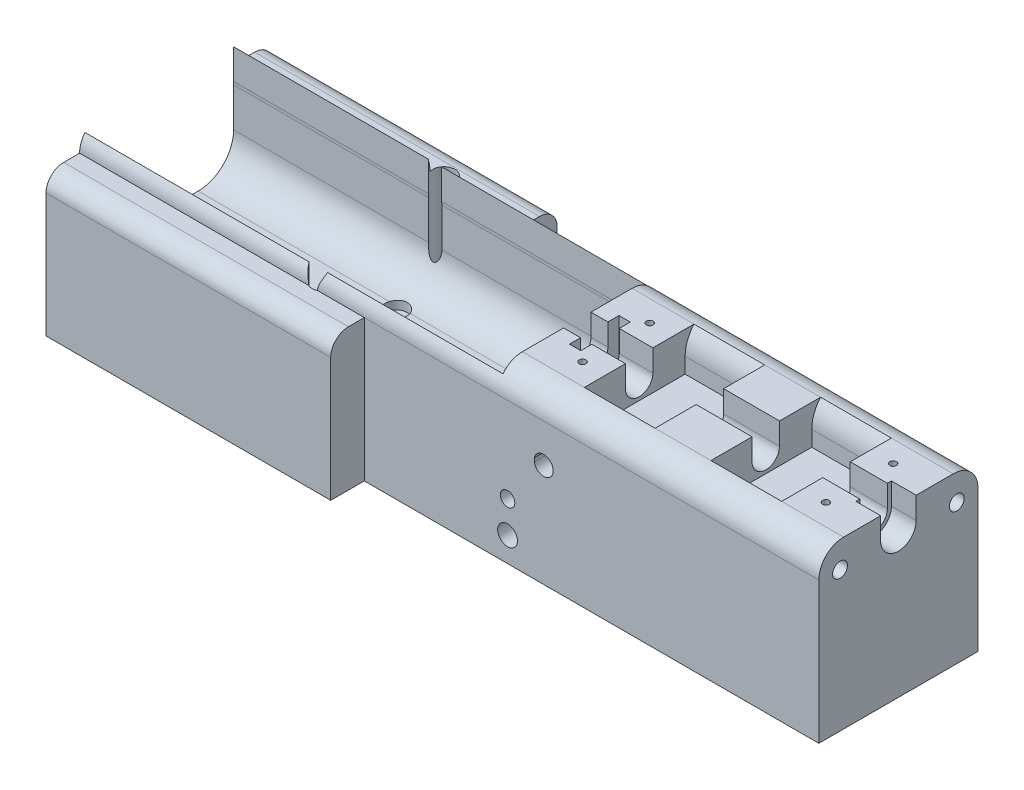
from build123d import *
from OCP.BRepFilletAPI import BRepFilletAPI_MakeChamfer

# Parameters (mm, degrees)
SKETCH1_W            = 218
SKETCH1_H            = 45
BOSS_EXTRUDE1_DEPTH  = 42
SKETCH7_W            = 118.2
SKETCH7_H            = 42
CUT_EXTRUDE17_DEPTH  = 21
SKETCH4_W            = 7.75
SKETCH4_H            = 6.175
CUT_EXTRUDE14_DEPTH  = 97.8
SKETCH5_R            = 3.875
CUT_EXTRUDE15_DEPTH  = 97.8
SKETCH11_W           = 3.2
SKETCH11_H           = 14
CUT_EXTRUDE19_DEPTH  = 12.5
CUT_EXTRUDE43_DEPTH  = 7
SKETCH53_R           = 2.1
CUT_EXTRUDE44_DEPTH  = 95
SKETCH68_R           = 2.65
CUT_EXTRUDE57_DEPTH  = 28.3
BOSS_EXTRUDE2_DEPTH  = 5
SKETCH42_W           = 80.5
SKETCH42_H           = 9.5
BOSS_EXTRUDE3_DEPTH  = 35
FILLET1_START        = -1
FILLET1_DEPTH        = 220
FILLET7_R            = 5
SKETCH56_W           = 15.8
SKETCH56_H           = 10.4
CUT_EXTRUDE47_DEPTH  = 32.15
SKETCH57_W           = 5
SKETCH57_H           = 10.4
CUT_EXTRUDE48_DEPTH  = 15
CUT_EXTRUDE51_DEPTH  = 9
SKETCH83_W           = 20
SKETCH83_H           = 26
CUT_EXTRUDE67_DEPTH  = 11
CHAMFER3_SIZE        = 2.5
CHAMFER3_SIZE_2      = 1.623518983
FILLET20_R           = 10
SKETCH84_R           = 0.95
CUT_EXTRUDE69_DEPTH  = 11
CUT_EXTRUDE76_DEPTH  = 118.2
SKETCH106_R          = 3.1
CUT_EXTRUDE77_DEPTH  = 4.7
SKETCH107_R          = 5.75
CUT_EXTRUDE78_DEPTH  = 4
SKETCH109_R          = 1.5
CUT_EXTRUDE80_DEPTH  = 25
SKETCH110_R          = 1.5
CUT_EXTRUDE81_DEPTH  = 14
SKETCH111_R          = 1.4
CUT_EXTRUDE82_DEPTH  = 7
SKETCH112_R          = 2.8
CUT_EXTRUDE83_DEPTH  = 9.95
SKETCH113_R          = 2.8
SKETCH113_R_2        = 2.05
CUT_EXTRUDE84_DEPTH  = 10
SKETCH59_R           = 1.5
SKETCH59_R_2         = 0.95
CUT_EXTRUDE50_DEPTH  = 6.5
SKETCH115_R          = 5.5
CUT_EXTRUDE85_DEPTH  = 10
CUT_EXTRUDE86_START  = -4
SKETCH116_R          = 2.8
CUT_EXTRUDE86_DEPTH  = 41
CUT_EXTRUDE87_START  = -11.7
SKETCH117_R          = 3.1
CUT_EXTRUDE87_DEPTH  = 44
SKETCH129_R          = 1.4
CUT_EXTRUDE99_DEPTH  = 8
SKETCH131_R          = 1.5
CUT_EXTRUDE100_DEPTH = 7


with BuildPart() as part:
    # Sketch1 → Boss-Extrude1 (new body)
    with BuildSketch(Plane(origin=(0, 0, 0), x_dir=(1, 0, 0), z_dir=(0, 1, 0))):
        with Locations((109, 22.5)):
            Rectangle(SKETCH1_W, SKETCH1_H)
    extrude(amount=BOSS_EXTRUDE1_DEPTH)

    # Sketch7 → Cut-Extrude17 (cut)
    with BuildSketch(Plane(origin=(0, 42, 0), x_dir=(1, 0, 0), z_dir=(0, 1, 0))):
        with Locations((68.1, 22.5)):
            Rectangle(SKETCH7_W, SKETCH7_H)
    extrude(amount=-CUT_EXTRUDE17_DEPTH, mode=Mode.SUBTRACT)

    # Sketch4 → Cut-Extrude14 (cut)
    with BuildSketch(Plane(origin=(218, 0, 0), x_dir=(0, 0, -1), z_dir=(1, 0, 0))):
        with Locations((22.5, 38.9125)):
            Rectangle(SKETCH4_W, SKETCH4_H)
    extrude(amount=-CUT_EXTRUDE14_DEPTH, mode=Mode.SUBTRACT)

    # Sketch5 → Cut-Extrude15 (cut)
    with BuildSketch(Plane(origin=(218, 0, 0), x_dir=(0, 0, -1), z_dir=(1, 0, 0))):
        with Locations((22.5, 35.825)):
            Circle(SKETCH5_R)
    extrude(amount=-CUT_EXTRUDE15_DEPTH, mode=Mode.SUBTRACT)

    # Sketch11 → Cut-Extrude19 (cut)
    with BuildSketch(Plane(origin=(0, 42, 0), x_dir=(1, 0, 0), z_dir=(0, 1, 0))):
        with Locations((133.6, 22.5)):
            Rectangle(SKETCH11_W, SKETCH11_H)
    extrude(amount=-CUT_EXTRUDE19_DEPTH, mode=Mode.SUBTRACT)

    # Sketch52 → Cut-Extrude43 (cut)
    with BuildSketch(Plane(origin=(218, 0, 0), x_dir=(0, 0, -1), z_dir=(1, 0, 0))):
        with BuildLine():
            Line((17.475, 42), (17.475, 35.825))
            ThreePointArc((17.475, 35.825), (22.5, 30.8), (27.525, 35.825))
            Line((27.525, 35.825), (27.525, 42))
            Line((27.525, 42), (17.475, 42))
        make_face()
    extrude(amount=-CUT_EXTRUDE43_DEPTH, mode=Mode.SUBTRACT)

    # Sketch53 → Cut-Extrude44 (cut)
    with BuildSketch(Plane(origin=(218, 0, 0), x_dir=(0, 0, -1), z_dir=(1, 0, 0))):
        with Locations((6, 34.5)):
            Circle(SKETCH53_R)
        with Locations((39, 34.5)):
            Circle(SKETCH53_R)
    extrude(amount=-CUT_EXTRUDE44_DEPTH, mode=Mode.SUBTRACT)

    # Sketch68 → Cut-Extrude57 (cut)
    with BuildSketch(Plane.ZY.offset(-127.2)):
        with Locations((-6, 34.5)):
            Circle(SKETCH68_R)
        with Locations((-39, 34.5)):
            Circle(SKETCH68_R)
    extrude(amount=-CUT_EXTRUDE57_DEPTH, mode=Mode.SUBTRACT)

    # Sketch14 → Boss-Extrude2 (add)
    with BuildSketch(Plane.XZ):
        Polygon((9, -54.5), (89.5, -54.5), (89.5, -45), (218, -45), (218, 0), (89.5, 0), (89.5, 9.5), (9, 9.5), (9, 0), (0, 0), (0, -45), (9, -45), align=None)
    extrude(amount=BOSS_EXTRUDE2_DEPTH)

    # Sketch42 → Boss-Extrude3 (add)
    with BuildSketch(Plane(origin=(0, 0, 0), x_dir=(1, 0, 0), z_dir=(0, 1, 0))):
        with Locations((49.25, -4.75)):
            Rectangle(SKETCH42_W, SKETCH42_H)
        with Locations((49.25, 49.75)):
            Rectangle(SKETCH42_W, SKETCH42_H)
    extrude(amount=BOSS_EXTRUDE3_DEPTH)

    # Fillet1: read off the stored shape, not the designer's step
    # Fillet1 outline → Fillet1 (cut)
    with BuildSketch(Plane.YZ.offset(FILLET1_START)):
        with BuildLine():
            ThreePointArc((42, -38), (39.949747468, -42.949747468), (35, -45))
            Line((35, -45), (42, -45))
            Line((42, -45), (42, -38))
        make_face()
        with BuildLine():
            Line((42, -7), (42, 0))
            Line((42, 0), (35, 0))
            ThreePointArc((35, 0), (39.949747468, -2.050252532), (42, -7))
        make_face()
    extrude(amount=FILLET1_DEPTH, mode=Mode.SUBTRACT)

    # Fillet7
    fillet7_edges = [part.edges().sort_by_distance(p)[0] for p in [
        (49.25, 35, -54.5),
        (49.25, 35, 9.5),
    ]]
    fillet(fillet7_edges, radius=FILLET7_R)

    # Sketch56 → Cut-Extrude47 (cut)
    with BuildSketch(Plane.XZ.offset(5)):
        with Locations((135.1, -14.2)):
            Rectangle(SKETCH56_W, SKETCH56_H)
    extrude(amount=-CUT_EXTRUDE47_DEPTH, mode=Mode.SUBTRACT)

    # Sketch57 → Cut-Extrude48 (cut)
    with BuildSketch(Plane.XZ.offset(5)):
        with Locations((124.7, -14.2)):
            Rectangle(SKETCH57_W, SKETCH57_H)
    extrude(amount=-CUT_EXTRUDE48_DEPTH, mode=Mode.SUBTRACT)

    # Sketch62 → Cut-Extrude51 (cut)
    with BuildSketch(Plane.ZY):
        with BuildLine():
            Line((0, -5), (-45, -5))
            Line((-45, -5), (-45, 35))
            ThreePointArc((-45, 35), (-42.949747468, 39.949747468), (-38, 42))
            Line((-38, 42), (-7, 42))
            ThreePointArc((-7, 42), (-2.050252532, 39.949747468), (0, 35))
            Line((0, 35), (0, -5))
        make_face()
    extrude(amount=-CUT_EXTRUDE51_DEPTH, mode=Mode.SUBTRACT)

    # Sketch83 → Cut-Extrude67 (cut)
    with BuildSketch(Plane(origin=(0, 42, 0), x_dir=(1, 0, 0), z_dir=(0, 1, 0))):
        with Locations((154.7, 22.5)):
            Rectangle(SKETCH83_W, SKETCH83_H)
        with Locations((190.5, 22.5)):
            Rectangle(SKETCH83_W, SKETCH83_H)
    extrude(amount=-CUT_EXTRUDE67_DEPTH, mode=Mode.SUBTRACT)

    # Chamfer3
    chamfer3_edges_1 = [part.edges().sort_by_distance(p)[0] for p in [
        (154.7, 42, -9.5),
    ]]
    chamfer3_side_1 = [part.faces().sort_by_distance(p)[0] for p in [
        (154.7, 42, -9.46752962),
    ]]
    chamfer3_edges_2 = [part.edges().sort_by_distance(p)[0] for p in [
        (190.5, 42, -9.5),
    ]]
    chamfer3_side_2 = [part.faces().sort_by_distance(p)[0] for p in [
        (190.5, 42, -9.46752962),
    ]]
    chamfer3_edges_3 = [part.edges().sort_by_distance(p)[0] for p in [
        (154.7, 42, -35.5),
    ]]
    chamfer3_side_3 = [part.faces().sort_by_distance(p)[0] for p in [
        (154.7, 42, -35.53247038),
    ]]
    chamfer3_edges_4 = [part.edges().sort_by_distance(p)[0] for p in [
        (190.5, 42, -35.5),
    ]]
    chamfer3_side_4 = [part.faces().sort_by_distance(p)[0] for p in [
        (190.5, 42, -35.53247038),
    ]]
    chamfer3 = BRepFilletAPI_MakeChamfer(part.part.solid().wrapped)
    for e in chamfer3_edges_1:
        chamfer3.Add(CHAMFER3_SIZE - 0.0001, CHAMFER3_SIZE_2 - 0.0001, e.wrapped, chamfer3_side_1[0].wrapped)
    for e in chamfer3_edges_2:
        chamfer3.Add(CHAMFER3_SIZE - 0.0001, CHAMFER3_SIZE_2 - 0.0001, e.wrapped, chamfer3_side_2[0].wrapped)
    for e in chamfer3_edges_3:
        chamfer3.Add(CHAMFER3_SIZE - 0.0001, CHAMFER3_SIZE_2 - 0.0001, e.wrapped, chamfer3_side_3[0].wrapped)
    for e in chamfer3_edges_4:
        chamfer3.Add(CHAMFER3_SIZE - 0.0001, CHAMFER3_SIZE_2 - 0.0001, e.wrapped, chamfer3_side_4[0].wrapped)
    add(Compound.cast(chamfer3.Shape()), mode=Mode.REPLACE)  # a hair under: the kernel refuses the full size

    # Fillet20
    # the kernel refuses this fillet: 10 mm, written as the material it takes off along each edge
    with BuildSketch(Plane(origin=(180.5, 40.376581017, -35.5), x_dir=(0, -1, 0), z_dir=(1, 0, 0))) as fillet20_piece_1:
        with BuildLine():
            CenterArc((4.990845904, 10), FILLET20_R, 228.591244129, 41.408755871)
            Line((-1.623418983, 2.4999), (-1.755704281, 2.349898))
            ThreePointArc((-1.755704281, 2.349898), (-0.97944468, 1.141023848), (-0.167735188, -0.108926152))
            Line((-0.167735188, -0.108926152), (0, -0.2))
            Line((0, -0.2), (4.990845904, -0.2))
            Line((4.990845904, -0.2), (4.990845904, 0))
        make_face()
    extrude(amount=20, mode=Mode.SUBTRACT)
    with BuildSketch(Plane(origin=(200.5, 40.376581017, -9.5), x_dir=(0, 0.5446307621074148, 0.8386759403764346), z_dir=(-1, 0, 0))) as fillet20_piece_2:
        with BuildLine():
            CenterArc((5.668591196, -9.632010003), FILLET20_R, 105.591809311, 41.408755871)
            Line((-2.718168208, -4.185702381), (-2.885903396, -4.076776229))
            Line((-2.885903396, -4.076776229), (-0.167735188, 0.108926152))
            Line((-0.167735188, 0.108926152), (0, 0.2))
            ThreePointArc((0, 0.2), (1.490384951, 0.2), (2.927013475, 0.1926402))
            Line((2.927013475, 0.1926402), (2.980769901, 0))
        make_face()
    extrude(amount=20, mode=Mode.SUBTRACT)
    with BuildSketch(Plane(origin=(164.7, 40.376581017, -35.5), x_dir=(0, 0.5446307621074188, -0.8386759403764318), z_dir=(-1, 0, 0))) as fillet20_piece_3:
        with BuildLine():
            CenterArc((5.668591196, 9.632010003), FILLET20_R, 212.999434818, 41.408755871)
            Line((-2.718168208, 4.185702381), (-2.885903396, 4.076776229))
            Line((-2.885903396, 4.076776229), (-0.167735188, -0.108926152))
            Line((-0.167735188, -0.108926152), (0, -0.2))
            ThreePointArc((0, -0.2), (1.490384951, -0.2), (2.927013475, -0.1926402))
            Line((2.927013475, -0.1926402), (2.980769901, 0))
        make_face()
    extrude(amount=20, mode=Mode.SUBTRACT)
    with BuildSketch(Plane(origin=(144.7, 40.376581017, -9.5), x_dir=(0, -1, 0), z_dir=(1, 0, 0))) as fillet20_piece_4:
        with BuildLine():
            CenterArc((4.990845904, -10), FILLET20_R, 90, 41.408755871)
            Line((-1.623418983, -2.4999), (-1.755704281, -2.349898))
            ThreePointArc((-1.755704281, -2.349898), (-0.97944468, -1.141023848), (-0.167735188, 0.108926152))
            Line((-0.167735188, 0.108926152), (0, 0.2))
            Line((0, 0.2), (4.990845904, 0.2))
            Line((4.990845904, 0.2), (4.990845904, 0))
        make_face()
    extrude(amount=20, mode=Mode.SUBTRACT)

    # Sketch84 → Cut-Extrude69 (cut)
    with BuildSketch(Plane(origin=(0, 42, 0), x_dir=(1, 0, 0), z_dir=(0, 1, 0))):
        with Locations(Location((138.2, 32, 0), (0, 0, 270))):
            Circle(SKETCH84_R)
        with Locations(Location((207, 32, 0), (0, 0, 270))):
            Circle(SKETCH84_R)
        with Locations(Location((138.2, 13, 0), (0, 0, 270))):
            Circle(SKETCH84_R)
        with Locations(Location((207, 13, 0), (0, 0, 270))):
            Circle(SKETCH84_R)
    extrude(amount=-CUT_EXTRUDE69_DEPTH, mode=Mode.SUBTRACT)

    # Sketch105 → Cut-Extrude76 (cut)
    with BuildSketch(Plane(origin=(127.2, 21, -22.5), x_dir=(0, 0, -1), z_dir=(-1, 0, 0))):
        with BuildLine():
            Line((-10.959716831, -18.950283169), (11.040283169, -18.950283169))
            ThreePointArc((11.040283169, -18.950283169), (18.111350981, -16.021350981), (21.040283169, -8.950283169))
            Line((21.040283169, -8.950283169), (21.040283169, 2.049716831))
            ThreePointArc((21.040283169, 2.049716831), (18.111350981, 9.120784643), (11.040283169, 12.049716831))
            Line((11.040283169, 12.049716831), (-10.959716831, 12.049716831))
            ThreePointArc((-10.959716831, 12.049716831), (-18.030784643, 9.120784643), (-20.959716831, 2.049716831))
            Line((-20.959716831, 2.049716831), (-20.959716831, -8.950283169))
            ThreePointArc((-20.959716831, -8.950283169), (-18.030784643, -16.021350981), (-10.959716831, -18.950283169))
        make_face()
    extrude(amount=CUT_EXTRUDE76_DEPTH, mode=Mode.SUBTRACT)

    # Sketch106 → Cut-Extrude77 (cut)
    with BuildSketch(Plane(origin=(127.2, -5, -22.5), x_dir=(0, 0, -1), z_dir=(0, -1, 0))):
        with Locations((23.5, -61.2)):
            Circle(SKETCH106_R)
        with Locations((10, -61.2)):
            Circle(SKETCH106_R)
    extrude(amount=-CUT_EXTRUDE77_DEPTH, mode=Mode.SUBTRACT)

    # Sketch107 → Cut-Extrude78 (cut)
    with BuildSketch(Plane(origin=(127.2, -5, -22.5), x_dir=(0, 0, -1), z_dir=(0, -1, 0))):
        with Locations((20, -73.2)):
            Circle(SKETCH107_R)
        with Locations((-20, -73.2)):
            Circle(SKETCH107_R)
    extrude(amount=-CUT_EXTRUDE78_DEPTH, mode=Mode.SUBTRACT)

    # Sketch109 → Cut-Extrude80 (cut)
    with BuildSketch(Plane(origin=(127.2, -5, -22.5), x_dir=(0, 0, -1), z_dir=(0, -1, 0))):
        with Locations((-20, -52.2)):
            Circle(SKETCH109_R)
    extrude(amount=-CUT_EXTRUDE80_DEPTH, mode=Mode.SUBTRACT)

    # Sketch110 → Cut-Extrude81 (cut)
    with BuildSketch(Plane(origin=(127.2, -5, -22.5), x_dir=(0, 0, -1), z_dir=(0, -1, 0))):
        with Locations((-1, -71.2)):
            Circle(SKETCH110_R)
    extrude(amount=-CUT_EXTRUDE81_DEPTH, mode=Mode.SUBTRACT)

    # Sketch111 → Cut-Extrude82 (cut)
    with BuildSketch(Plane(origin=(9, 21, -22.5), x_dir=(0, 0, -1), z_dir=(-1, 0, 0))):
        with Locations(Location((27, -9, 0), (0, 0, 180))):
            Circle(SKETCH111_R)
        with Locations(Location((27, 21, 0), (0, 0, 180))):
            Circle(SKETCH111_R)
        with Locations(Location((-27, 21, 0), (0, 0, 180))):
            Circle(SKETCH111_R)
        with Locations(Location((-27, -9, 0), (0, 0, 180))):
            Circle(SKETCH111_R)
    extrude(amount=-CUT_EXTRUDE82_DEPTH, mode=Mode.SUBTRACT)

    # Sketch112 → Cut-Extrude83 (cut)
    with BuildSketch(Plane(origin=(127.2, 8.950283169, -22.5), x_dir=(0, 0, 1), z_dir=(0, 1, 0))):
        with Locations((1, -71.2)):
            Circle(SKETCH112_R)
    extrude(amount=-CUT_EXTRUDE83_DEPTH, mode=Mode.SUBTRACT)

    # Sketch113 → Cut-Extrude84 (cut)
    with BuildSketch(Plane(origin=(127.2, 21, 0), x_dir=(0, -1, 0), z_dir=(0, 0, 1))):
        with Locations(Location((19.05, 2.8, 0), (0, 0, 90))):
            Circle(SKETCH113_R)
        with Locations(Location((10.15, 2.8, 0), (0, 0, 90))):
            Circle(SKETCH113_R_2)
        with BuildLine():
            Line((-2.632795978, 15.65), (-3.667204022, 15.65))
            ThreePointArc((-3.667204022, 15.65), (-5.85, 13), (-3.667204022, 10.35))
            Line((-3.667204022, 10.35), (-2.632795978, 10.35))
            ThreePointArc((-2.632795978, 10.35), (-0.45, 13), (-2.632795978, 15.65))
        make_face()
    extrude(amount=-CUT_EXTRUDE84_DEPTH, mode=Mode.SUBTRACT)

    # Sketch59 → Cut-Extrude50 (cut)
    with BuildSketch(Plane.XY.offset(-19.4)):
        with Locations((130, 1.95)):
            Circle(SKETCH59_R)
        with Locations((130, 10.85)):
            Circle(SKETCH59_R_2)
        with Locations((140.2, 24.15)):
            Circle(SKETCH59_R)
    extrude(amount=-CUT_EXTRUDE50_DEPTH, mode=Mode.SUBTRACT)

    # Sketch115 → Cut-Extrude85 (cut)
    with BuildSketch(Plane(origin=(127.2, -5, -22.5), x_dir=(0, 0, -1), z_dir=(0, -1, 0))):
        with Locations((0, -33.7)):
            Circle(SKETCH115_R)
    extrude(amount=-CUT_EXTRUDE85_DEPTH, mode=Mode.SUBTRACT)

    # Sketch116 → Cut-Extrude86 (cut)
    with BuildSketch(Plane(origin=(127.2, -5, -22.5), x_dir=(0, 0, -1), z_dir=(0, -1, 0)).offset(CUT_EXTRUDE86_START)):
        with Locations((-20, -52.2)):
            Circle(SKETCH116_R)
    extrude(amount=-CUT_EXTRUDE86_DEPTH, mode=Mode.SUBTRACT)

    # Sketch117 → Cut-Extrude87 (cut)
    with BuildSketch(Plane(origin=(127.2, -5, -22.5), x_dir=(0, 0, -1), z_dir=(0, -1, 0)).offset(CUT_EXTRUDE87_START)):
        with Locations((23.5, -61.2)):
            Circle(SKETCH117_R)
        with Locations((10, -61.2)):
            Circle(SKETCH117_R)
    extrude(amount=-CUT_EXTRUDE87_DEPTH, mode=Mode.SUBTRACT)

    # Sketch129 → Cut-Extrude99 (cut)
    with BuildSketch(Plane(origin=(9, 21, -22.5), x_dir=(0, 0, -1), z_dir=(-1, 0, 0))):
        with Locations(Location((27, -9, 0), (0, 0, 180))):
            Circle(SKETCH129_R)
        with Locations(Location((27, 21, 0), (0, 0, 180))):
            Circle(SKETCH129_R)
        with Locations(Location((-27, 21, 0), (0, 0, 180))):
            Circle(SKETCH129_R)
        with Locations(Location((-27, -9, 0), (0, 0, 180))):
            Circle(SKETCH129_R)
    extrude(amount=-CUT_EXTRUDE99_DEPTH, mode=Mode.SUBTRACT)

    # Sketch131 → Cut-Extrude100 (cut)
    with BuildSketch(Plane(origin=(127.2, -0.3, -22.5), x_dir=(0, 0, -1), z_dir=(0, -1, 0))):
        with Locations((23.5, -61.2)):
            Circle(SKETCH131_R)
        with Locations((10, -61.2)):
            Circle(SKETCH131_R)
    extrude(amount=-CUT_EXTRUDE100_DEPTH, mode=Mode.SUBTRACT)


solid = part.part
